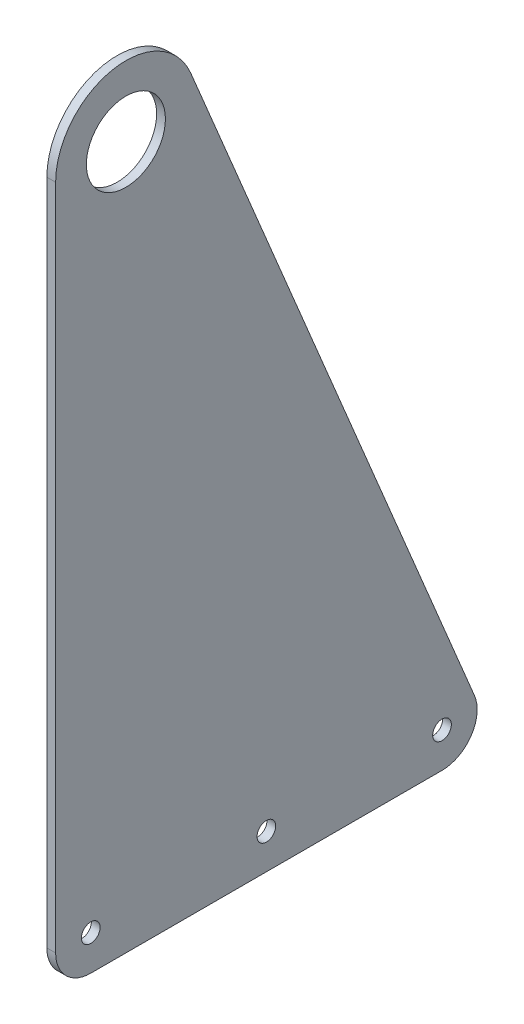
from build123d import *

# Parameters (mm, degrees)
SKETCH1_R           = 14.2875
SKETCH1_R_2         = 3.3782
BOSS_EXTRUDE1_DEPTH = 3.175


with BuildPart() as part:
    # Sketch1 → Boss-Extrude1 (new body)
    with BuildSketch(Plane(origin=(0, 0, 0), x_dir=(0, 0, -1), z_dir=(1, 0, 0))):
        with BuildLine():
            Line((-25.4, -241.3), (-25.4, 0))
            ThreePointArc((-25.4, 0), (-4.981349833, 24.906749163), (23.446153846, 9.769230769))
            Line((23.446153846, 9.769230769), (126.023076923, -236.415384615))
            ThreePointArc((126.023076923, -236.415384615), (124.867038738, -248.344692492), (114.3, -254))
            Line((114.3, -254), (-12.7, -254))
            ThreePointArc((-12.7, -254), (-21.680256121, -250.280256121), (-25.4, -241.3))
        make_face()
        Circle(SKETCH1_R, mode=Mode.SUBTRACT)
        with Locations((-12.7, -241.3)):
            Circle(SKETCH1_R_2, mode=Mode.SUBTRACT)
        with Locations((50.8, -241.3)):
            Circle(SKETCH1_R_2, mode=Mode.SUBTRACT)
        with Locations((114.3, -241.3)):
            Circle(SKETCH1_R_2, mode=Mode.SUBTRACT)
    extrude(amount=BOSS_EXTRUDE1_DEPTH)


solid = part.part
